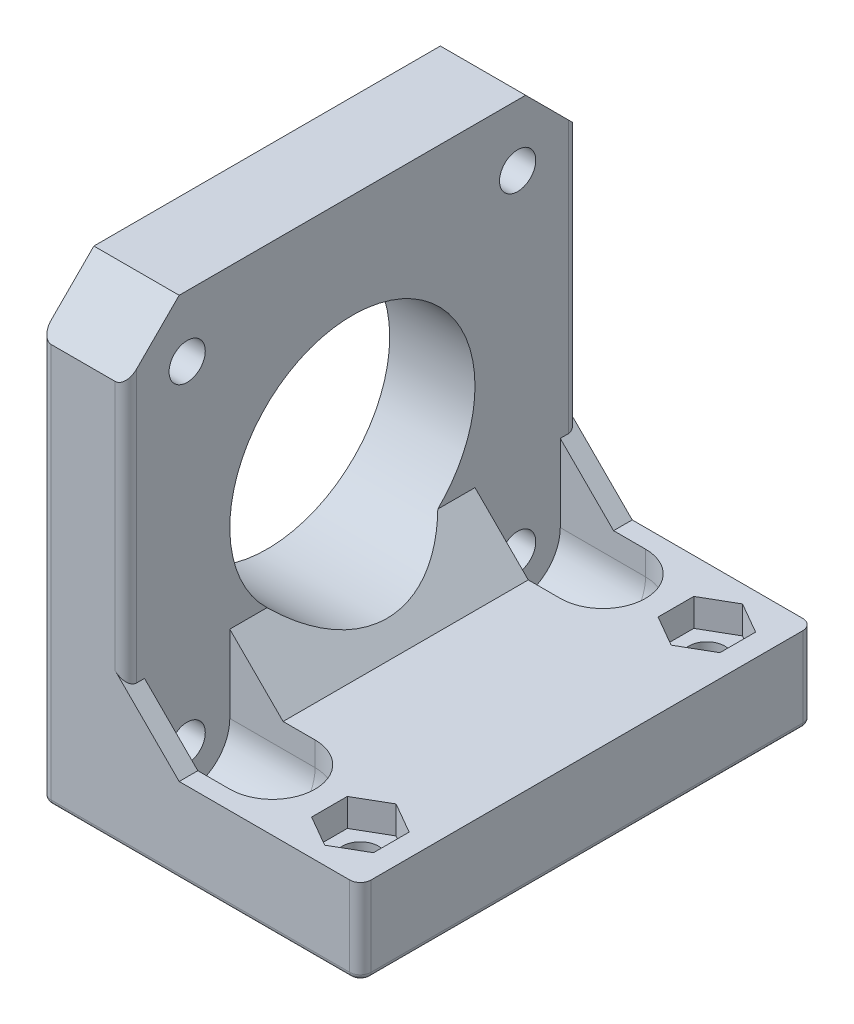
from build123d import *

# Parameters (mm, degrees)
SKETCH1_W           = 42.5
SKETCH1_H           = 42.5
BOSS_EXTRUDE1_DEPTH = 8
SKETCH2_R           = 1.7
SKETCH2_R_2         = 11.5
CUT_EXTRUDE1_DEPTH  = 35
BOSS_EXTRUDE2_DEPTH = 22
BOSS_EXTRUDE3_REACH = 52.416
SKETCH5_W           = 10
SKETCH5_H           = 42.5
FILLET1_R           = 4
FILLET2_R           = 4
CHAMFER2_SIZE       = 5
CUT_EXTRUDE2_DEPTH  = 2.6
SKETCH7_R           = 1.7
CUT_EXTRUDE3_DEPTH  = 10.6
CHAMFER3_SIZE       = 5
FILLET3_R           = 1
FILLET4_R           = 1
FILLET5_R           = 0.5


# Some blends are built 0.0001 mm under size
with BuildPart() as part:
    # Sketch1 → Boss-Extrude1 (new body)
    with BuildSketch(Plane(origin=(0, 0, 0), x_dir=(0, 0, -1), z_dir=(1, 0, 0))):
        Rectangle(SKETCH1_W, SKETCH1_H)
    extrude(amount=BOSS_EXTRUDE1_DEPTH)

    # Sketch2 → Cut-Extrude1 (cut)
    with BuildSketch(Plane(origin=(8, 0, 0), x_dir=(0, 0, -1), z_dir=(1, 0, 0))):
        with Locations((-15.5, 15.5)):
            Circle(SKETCH2_R)
        with Locations((15.5, 15.5)):
            Circle(SKETCH2_R)
        with Locations((-15.5, -15.5)):
            Circle(SKETCH2_R)
        with Locations((15.5, -15.5)):
            Circle(SKETCH2_R)
        Circle(SKETCH2_R_2)
    extrude(amount=-CUT_EXTRUDE1_DEPTH, mode=Mode.SUBTRACT)

    # Sketch3 → Boss-Extrude2 (add)
    with BuildSketch(Plane(origin=(8, 0, 0), x_dir=(0, 0, -1), z_dir=(1, 0, 0))):
        with BuildLine():
            Line((-19.5, -13.25), (-21.25, -13.25))
            Line((-21.25, -13.25), (-21.25, -21.25))
            Line((-21.25, -21.25), (21.25, -21.25))
            Line((21.25, -21.25), (21.25, -13.25))
            Line((21.25, -13.25), (19.5, -13.25))
            Line((19.5, -13.25), (19.5, -15.5))
            ThreePointArc((19.5, -15.5), (15.5, -19.5), (11.5, -15.5))
            Line((11.5, -15.5), (11.5, -13.25))
            Line((11.5, -13.25), (-11.5, -13.25))
            Line((-11.5, -13.25), (-11.5, -15.5))
            ThreePointArc((-11.5, -15.5), (-15.5, -19.5), (-19.5, -15.5))
            Line((-19.5, -15.5), (-19.5, -13.25))
        make_face()
    extrude(amount=BOSS_EXTRUDE2_DEPTH)

    # Boss-Extrude3: up to this face of the body (flat: up to its plane)
    boss_extrude3_end = Plane(part.part.faces().sort_by_distance((15, -21.25, 0))[0])
    # Sketch5 → Boss-Extrude3 (add, up to the picked face)
    with BuildSketch(Plane(origin=(0, -13.25, 0), x_dir=(1, 0, 0), z_dir=(0, 1, 0)), mode=Mode.PRIVATE) as boss_extrude3_sk1:
        with Locations((25, 0)):
            Rectangle(SKETCH5_W, SKETCH5_H)
    boss_extrude3_tool1 = split(extrude(boss_extrude3_sk1.sketch, amount=-BOSS_EXTRUDE3_REACH, mode=Mode.PRIVATE), bisect_by=boss_extrude3_end, keep=Keep.BOTH, mode=Mode.PRIVATE)
    add(boss_extrude3_tool1.solids().sort_by(Axis((25, -13.25, 0), (0, -1, 0)))[0])

    # Fillet1
    fillet1_edges = [part.edges().sort_by_distance(p)[0] for p in [
        (20, -14.375, 11.5),
        (20, -19.5, 15.5),
        (20, -14.375, 19.5),
    ]]
    fillet(fillet1_edges, radius=FILLET1_R - 0.0001)  # a hair under: the kernel refuses the full size

    # Fillet2
    fillet2_edges = [part.edges().sort_by_distance(p)[0] for p in [
        (20, -14.375, -11.5),
        (20, -19.5, -15.5),
        (20, -14.375, -19.5),
    ]]
    fillet(fillet2_edges, radius=FILLET2_R - 0.0001)  # a hair under: the kernel refuses the full size

    # Chamfer2
    # the kernel refuses this chamfer: 5 mm, written as the material it adds along each edge
    with BuildSketch(Plane(origin=(8, -13.25, -21.25), x_dir=(0.9996219169112968, -0.027495876610586317, 0), z_dir=(0, 0, 1)), Plane(origin=(8, -13.25, 19.5), x_dir=(0.9996219169112968, -0.027495876610586317, 0), z_dir=(0, 0, 1))) as chamfer2_piece_1:
        Polygon((CHAMFER2_SIZE * 0.999621916911, CHAMFER2_SIZE * 0.0274958766106), (-CHAMFER2_SIZE * 0.0274958766106, CHAMFER2_SIZE * 0.999621916911), (0, 0), align=None)
    extrude(amount=1.75)
    with BuildSketch(Plane(origin=(8, -13.25, -21.25), x_dir=(0.9996219169112968, -0.027495876610586317, 0), z_dir=(0, 0, 1))) as chamfer2_piece_2_section:
        Polygon((CHAMFER2_SIZE * 0.999621916911, CHAMFER2_SIZE * 0.0274958766106), (-CHAMFER2_SIZE * 0.0274958766106, CHAMFER2_SIZE * 0.999621916911), (0, 0), align=None)
    chamfer2_piece_2 = extrude(amount=14.60841494, mode=Mode.PRIVATE)
    chamfer2_piece_2 = split(chamfer2_piece_2, bisect_by=Plane(origin=(9.660792582, -11.623563686, -11.5), z_dir=(0, 0, 1)), keep=Keep.TOP, mode=Mode.PRIVATE)
    chamfer2_piece_2 = chamfer2_piece_2 - Plane(origin=(9.660792582, 0, 0), x_dir=(0, 0, -1), z_dir=(1, 0, 0)) * Cylinder(11.5, 50, mode=Mode.PRIVATE)
    add(chamfer2_piece_2)
    with BuildSketch(Plane(origin=(8, -13.25, 6.64158506), x_dir=(0.9996219169112968, -0.027495876610586313, 0), z_dir=(0, 0, 1))) as chamfer2_piece_3_section:
        Polygon((CHAMFER2_SIZE * 0.999621916911, CHAMFER2_SIZE * 0.0274958766106), (-CHAMFER2_SIZE * 0.0274958766106, CHAMFER2_SIZE * 0.999621916911), (0, 0), align=None)
    chamfer2_piece_3 = extrude(amount=14.60841494, mode=Mode.PRIVATE)
    chamfer2_piece_3 = split(chamfer2_piece_3, bisect_by=Plane(origin=(9.660792582, -11.623563686, 11.5), z_dir=(0, 0, -1)), keep=Keep.TOP, mode=Mode.PRIVATE)
    chamfer2_piece_3 = chamfer2_piece_3 - Plane(origin=(9.660792582, 0, 0), x_dir=(0, 0, -1), z_dir=(1, 0, 0)) * Cylinder(11.5, 50, mode=Mode.PRIVATE)
    add(chamfer2_piece_3)
    with BuildSketch(Plane(origin=(8, -13.25, -24.35841494), x_dir=(0.9996219169112968, -0.027495876610586313, 0), z_dir=(0, 0, 1))) as chamfer2_piece_4_section:
        Polygon((CHAMFER2_SIZE * 0.999621916911, CHAMFER2_SIZE * 0.0274958766106), (-CHAMFER2_SIZE * 0.0274958766106, CHAMFER2_SIZE * 0.999621916911), (0, 0), align=None)
    chamfer2_piece_4 = extrude(amount=35.85841494, mode=Mode.PRIVATE)
    chamfer2_piece_4 = split(chamfer2_piece_4, bisect_by=Plane(origin=(9.648968134, -11.601031866, -19.5), z_dir=(0, 0, -1)), keep=Keep.TOP, mode=Mode.PRIVATE)
    chamfer2_piece_4 = split(chamfer2_piece_4, bisect_by=Plane(origin=(9.648968134, -11.601031866, -21.25), z_dir=(0, 0, 1)), keep=Keep.TOP, mode=Mode.PRIVATE)
    add(chamfer2_piece_4)
    with BuildSketch(Plane(origin=(8, -13.25, -11.5), x_dir=(0.9996219169112968, -0.027495876610586317, 0), z_dir=(0, 0, 1))) as chamfer2_piece_5_section:
        Polygon((CHAMFER2_SIZE * 0.999621916911, CHAMFER2_SIZE * 0.0274958766106), (-CHAMFER2_SIZE * 0.0274958766106, CHAMFER2_SIZE * 0.999621916911), (0, 0), align=None)
    chamfer2_piece_5 = extrude(amount=23, mode=Mode.PRIVATE)
    chamfer2_piece_5 = chamfer2_piece_5 - Plane(origin=(9.815143963, 0, 0), x_dir=(0, 0, -1), z_dir=(1, 0, 0)) * Cylinder(11.5, 66, mode=Mode.PRIVATE)
    add(chamfer2_piece_5)
    with BuildSketch(Plane(origin=(8, -13.25, -11.5), x_dir=(0.9996219169112968, -0.027495876610586317, 0), z_dir=(0, 0, 1))) as chamfer2_piece_6_section:
        Polygon((CHAMFER2_SIZE * 0.999621916911, CHAMFER2_SIZE * 0.0274958766106), (-CHAMFER2_SIZE * 0.0274958766106, CHAMFER2_SIZE * 0.999621916911), (0, 0), align=None)
    chamfer2_piece_6 = extrude(amount=35.85841494, mode=Mode.PRIVATE)
    chamfer2_piece_6 = split(chamfer2_piece_6, bisect_by=Plane(origin=(9.648968134, -11.601031866, 19.5), z_dir=(0, 0, 1)), keep=Keep.TOP, mode=Mode.PRIVATE)
    chamfer2_piece_6 = split(chamfer2_piece_6, bisect_by=Plane(origin=(9.648968134, -11.601031866, 21.25), z_dir=(0, 0, -1)), keep=Keep.TOP, mode=Mode.PRIVATE)
    add(chamfer2_piece_6)

    # Sketch6 → Cut-Extrude2 (cut)
    with BuildSketch(Plane(origin=(0, -13.25, 0), x_dir=(1, 0, 0), z_dir=(0, 1, 0))):
        Polygon((25, 12.901368439), (27.9, 14.575684219), (27.9, 17.924315781), (25, 19.598631561), (22.1, 17.924315781), (22.1, 14.575684219), align=None)
        Polygon((25, -19.598631561), (27.9, -17.924315781), (27.9, -14.575684219), (25, -12.901368439), (22.1, -14.575684219), (22.1, -17.924315781), align=None)
    extrude(amount=-CUT_EXTRUDE2_DEPTH, mode=Mode.SUBTRACT)

    # Sketch7 → Cut-Extrude3 (cut)
    with BuildSketch(Plane(origin=(0, -15.85, 0), x_dir=(1, 0, 0), z_dir=(0, 1, 0))):
        with Locations(Location((25, 16.25, 0), (0, 0, 270))):
            Circle(SKETCH7_R)
        with Locations(Location((25, -16.25, 0), (0, 0, 270))):
            Circle(SKETCH7_R)
    extrude(amount=-CUT_EXTRUDE3_DEPTH, mode=Mode.SUBTRACT)

    # Chamfer3
    chamfer3_edges = [part.edges().sort_by_distance(p)[0] for p in [
        (4, 21.25, 21.25),
        (4, 21.25, -21.25),
    ]]
    chamfer(chamfer3_edges, length=CHAMFER3_SIZE)

    # Fillet3
    fillet3_edges = [part.edges().sort_by_distance(p)[0] for p in [
        (0, -2.5, 21.25),
        (30, -17.25, 21.25),
        (30, -17.25, -21.25),
        (0, -2.5, -21.25),
    ]]
    fillet(fillet3_edges, radius=FILLET3_R)

    # Fillet4
    fillet4_edges = [part.edges().sort_by_distance(p)[0] for p in [
        (8, 4, -21.25),
        (8, 4, 21.25),
    ]]
    fillet(fillet4_edges, radius=FILLET4_R)

    # Fillet5
    fillet5_edges = [part.edges().sort_by_distance(p)[0] for p in [
        (30, -21.25, 0),
        (15, -21.25, -21.25),
        (0, -21.25, 0),
        (15, -21.25, 21.25),
        (29.707106781, -21.25, 20.957106781),
        (0.292893219, -21.25, 20.957106781),
        (0.292893219, -21.25, -20.957106781),
        (29.707106781, -21.25, -20.957106781),
    ]]
    fillet(fillet5_edges, radius=FILLET5_R)


solid = part.part
